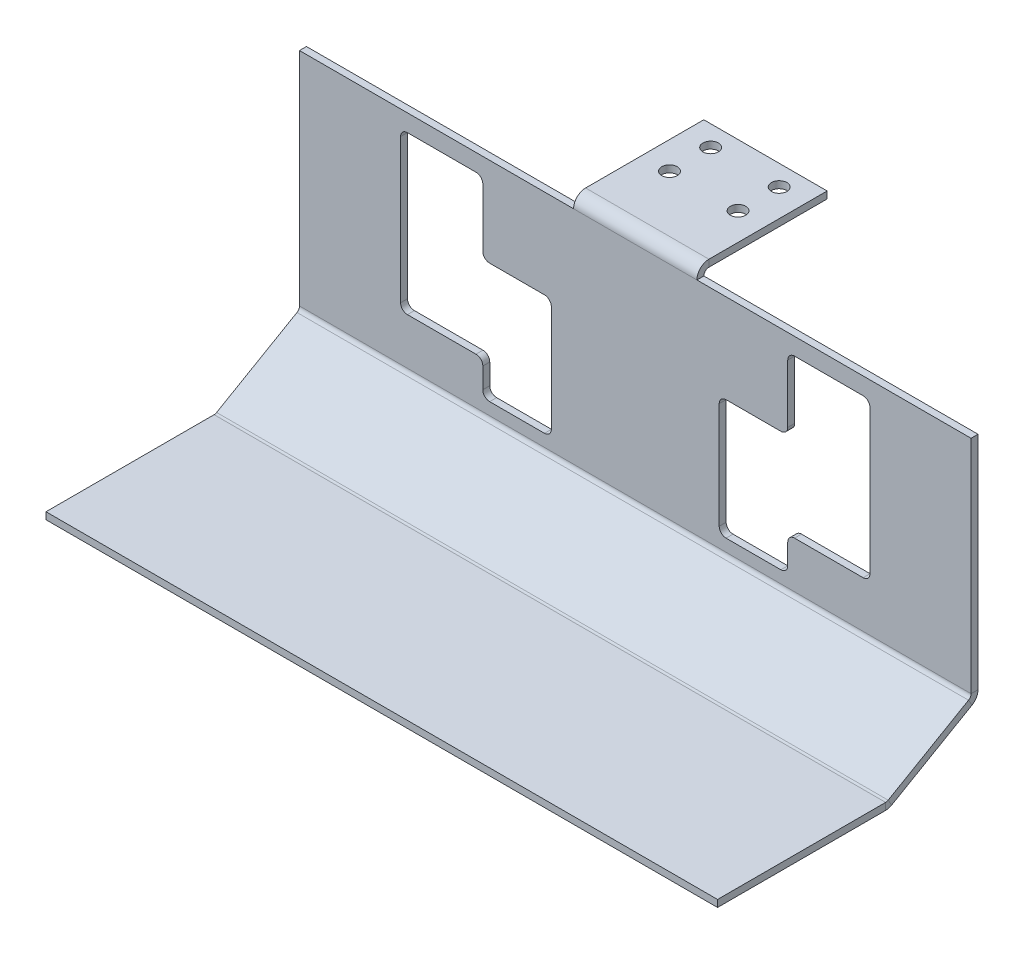
from build123d import *

# Parameters (mm, degrees)
SKETCH1_W                    = 98
SKETCH1_H                    = 32.71
BASE_FLANGE1_DEPTH           = 1.016
EDGE_FLANGE1_DEPTH           = 18
EDGE_FLANGE2_STRIP_CUT_DEPTH = 98
EDGE_FLANGE2_DEPTH           = 98
EDGE_FLANGE3_STRIP_CUT_DEPTH = 98
EDGE_FLANGE3_DEPTH           = 98
CUT_EXTRUDE1_REACH           = 115.066
SKETCH17_R                   = 1.1303


# Sheet-metal steps are written as plain solids
with BuildPart() as part:
    # Sketch1 → Base-Flange1 (new body)
    with BuildSketch(Plane.XY):
        with Locations((49, 16.355)):
            Rectangle(SKETCH1_W, SKETCH1_H)
        with BuildLine():
            Line((61.25, 18.71), (61.25, 3.21))
            ThreePointArc((61.25, 3.21), (61.542893219, 2.502893219), (62.25, 2.21))
            Line((62.25, 2.21), (70.25, 2.21))
            ThreePointArc((70.25, 2.21), (70.957106781, 2.502893219), (71.25, 3.21))
            Line((71.25, 3.21), (71.25, 6.21))
            ThreePointArc((71.25, 6.21), (71.542893219, 6.917106781), (72.25, 7.21))
            Line((72.25, 7.21), (82.25, 7.21))
            ThreePointArc((82.25, 7.21), (82.957106781, 7.502893219), (83.25, 8.21))
            Line((83.25, 8.21), (83.25, 29.21))
            ThreePointArc((83.25, 29.21), (82.957106781, 29.917106781), (82.25, 30.21))
            Line((82.25, 30.21), (72.25, 30.21))
            ThreePointArc((72.25, 30.21), (71.542893219, 29.917106781), (71.25, 29.21))
            Line((71.25, 29.21), (71.25, 20.71))
            ThreePointArc((71.25, 20.71), (70.957106781, 20.002893219), (70.25, 19.71))
            Line((70.25, 19.71), (62.25, 19.71))
            ThreePointArc((62.25, 19.71), (61.542893219, 19.417106781), (61.25, 18.71))
        make_face(mode=Mode.SUBTRACT)
        with BuildLine():
            Line((25.75, 30.21), (15.75, 30.21))
            ThreePointArc((15.75, 30.21), (15.042893219, 29.917106781), (14.75, 29.21))
            Line((14.75, 29.21), (14.75, 8.21))
            ThreePointArc((14.75, 8.21), (15.042893219, 7.502893219), (15.75, 7.21))
            Line((15.75, 7.21), (25.75, 7.21))
            ThreePointArc((25.75, 7.21), (26.457106781, 6.917106781), (26.75, 6.21))
            Line((26.75, 6.21), (26.75, 3.21))
            ThreePointArc((26.75, 3.21), (27.042893219, 2.502893219), (27.75, 2.21))
            Line((27.75, 2.21), (35.75, 2.21))
            ThreePointArc((35.75, 2.21), (36.457106781, 2.502893219), (36.75, 3.21))
            Line((36.75, 3.21), (36.75, 18.71))
            ThreePointArc((36.75, 18.71), (36.457106781, 19.417106781), (35.75, 19.71))
            Line((35.75, 19.71), (27.75, 19.71))
            ThreePointArc((27.75, 19.71), (27.042893219, 20.002893219), (26.75, 20.71))
            Line((26.75, 20.71), (26.75, 29.21))
            ThreePointArc((26.75, 29.21), (26.457106781, 29.917106781), (25.75, 30.21))
        make_face(mode=Mode.SUBTRACT)
    extrude(amount=-BASE_FLANGE1_DEPTH)

    # Edge-Flange1 section (across the edge) → Edge-Flange1 (add)
    with BuildSketch(Plane(origin=(40, 33.4466, -1.016), x_dir=(0, -1, 0), z_dir=(1, 0, 0))):
        with BuildLine():
            Line((-1.016, 0.7366), (-1.016, 17.984))
            Line((-1.016, 17.984), (0, 17.984))
            Line((0, 17.984), (0, 0.7366))
            ThreePointArc((0, 0.7366), (0.215745145, 0.215745145), (0.7366, 0))
            Line((0.7366, 0), (0.7366, -1.016))
            ThreePointArc((0.7366, -1.016), (-0.502675345, -0.502675345), (-1.016, 0.7366))
        make_face()
    extrude(amount=EDGE_FLANGE1_DEPTH)

    # Edge-Flange2 strip (across the edge) → Edge-Flange2 strip cut (cut)
    with BuildSketch(Plane(origin=(0, 0, 0), x_dir=(0, 0.8660254037844364, 0.5000000000000041), z_dir=(1, 0, 0))):
        Polygon((-4.935055866, 1.676080086), (-0.1397, -1.092519914), (0.3683, -0.212638104), (-4.427055866, 2.555961896), align=None)
    extrude(amount=EDGE_FLANGE2_STRIP_CUT_DEPTH, mode=Mode.SUBTRACT)

    # Edge-Flange2 section (across the edge) → Edge-Flange2 (add)
    with BuildSketch(Plane(origin=(0, 0, 0), x_dir=(0, 0.8660254037844364, 0.5000000000000041), z_dir=(1, 0, 0))):
        with BuildLine():
            Line((-1.016, 0.425276208), (-1.016, 14.163412127))
            Line((-1.016, 14.163412127), (0, 14.163412127))
            Line((0, 14.163412127), (0, 0.425276208))
            ThreePointArc((0, 0.425276208), (0.098685688, 0.056976208), (0.3683, -0.212638104))
            Line((0.3683, -0.212638104), (-0.1397, -1.092519914))
            ThreePointArc((-0.1397, -1.092519914), (-0.781196123, -0.451023792), (-1.016, 0.425276208))
        make_face()
    extrude(amount=EDGE_FLANGE2_DEPTH)

    # Edge-Flange3 strip (across the edge) → Edge-Flange3 strip cut (cut)
    with BuildSketch(Plane(origin=(0, -7.081706063, 12.265874706), x_dir=(0, 1, 0), z_dir=(1, 0, 0))):
        Polygon((-3.549796123, 4.116427241), (-0.781196123, -0.678928625), (0.098685688, -0.170928625), (-2.669914312, 4.624427241), align=None)
    extrude(amount=EDGE_FLANGE3_STRIP_CUT_DEPTH, mode=Mode.SUBTRACT)

    # Edge-Flange3 section (across the edge) → Edge-Flange3 (add)
    with BuildSketch(Plane(origin=(0, -7.081706063, 12.265874706), x_dir=(0, 1, 0), z_dir=(1, 0, 0))):
        with BuildLine():
            Line((-1.016, 0.197371375), (-1.016, 24.72776362))
            Line((-1.016, 24.72776362), (0, 24.72776362))
            Line((0, 24.72776362), (0, 0.197371375))
            ThreePointArc((0, 0.197371375), (0.025099036, 0.006725267), (0.098685688, -0.170928625))
            Line((0.098685688, -0.170928625), (-0.781196123, -0.678928625))
            ThreePointArc((-0.781196123, -0.678928625), (-0.956281603, -0.256234883), (-1.016, 0.197371375))
        make_face()
    extrude(amount=EDGE_FLANGE3_DEPTH)

    # Sketch17 → Cut-Extrude1 (cut, up to next)
    with BuildSketch(Plane(origin=(0, 34.4626, 0), x_dir=(1, 0, 0), z_dir=(0, 1, 0)), mode=Mode.PRIVATE) as cut_extrude1_sk1:
        with Locations(Location((54, 10, 0), (0, 0, 270))):
            Circle(SKETCH17_R)
    cut_extrude1_tool1 = extrude(cut_extrude1_sk1.sketch, amount=-CUT_EXTRUDE1_REACH, mode=Mode.PRIVATE) & part.part
    # Sketch17 → Cut-Extrude1 (cut, up to next)
    with BuildSketch(Plane(origin=(0, 34.4626, 0), x_dir=(1, 0, 0), z_dir=(0, 1, 0)), mode=Mode.PRIVATE) as cut_extrude1_sk2:
        with Locations(Location((54, 16, 0), (0, 0, 270))):
            Circle(SKETCH17_R)
    cut_extrude1_tool2 = extrude(cut_extrude1_sk2.sketch, amount=-CUT_EXTRUDE1_REACH, mode=Mode.PRIVATE) & part.part
    # Sketch17 → Cut-Extrude1 (cut, up to next)
    with BuildSketch(Plane(origin=(0, 34.4626, 0), x_dir=(1, 0, 0), z_dir=(0, 1, 0)), mode=Mode.PRIVATE) as cut_extrude1_sk3:
        with Locations(Location((44, 10, 0), (0, 0, 270))):
            Circle(SKETCH17_R)
    cut_extrude1_tool3 = extrude(cut_extrude1_sk3.sketch, amount=-CUT_EXTRUDE1_REACH, mode=Mode.PRIVATE) & part.part
    # Sketch17 → Cut-Extrude1 (cut, up to next)
    with BuildSketch(Plane(origin=(0, 34.4626, 0), x_dir=(1, 0, 0), z_dir=(0, 1, 0)), mode=Mode.PRIVATE) as cut_extrude1_sk4:
        with Locations(Location((44, 16, 0), (0, 0, 270))):
            Circle(SKETCH17_R)
    cut_extrude1_tool4 = extrude(cut_extrude1_sk4.sketch, amount=-CUT_EXTRUDE1_REACH, mode=Mode.PRIVATE) & part.part
    add(cut_extrude1_tool1.solids().sort_by_distance((54, 34.4626, -10))[0], mode=Mode.SUBTRACT)
    add(cut_extrude1_tool2.solids().sort_by_distance((54, 34.4626, -16))[0], mode=Mode.SUBTRACT)
    add(cut_extrude1_tool3.solids().sort_by_distance((44, 34.4626, -10))[0], mode=Mode.SUBTRACT)
    add(cut_extrude1_tool4.solids().sort_by_distance((44, 34.4626, -16))[0], mode=Mode.SUBTRACT)


solid = part.part
